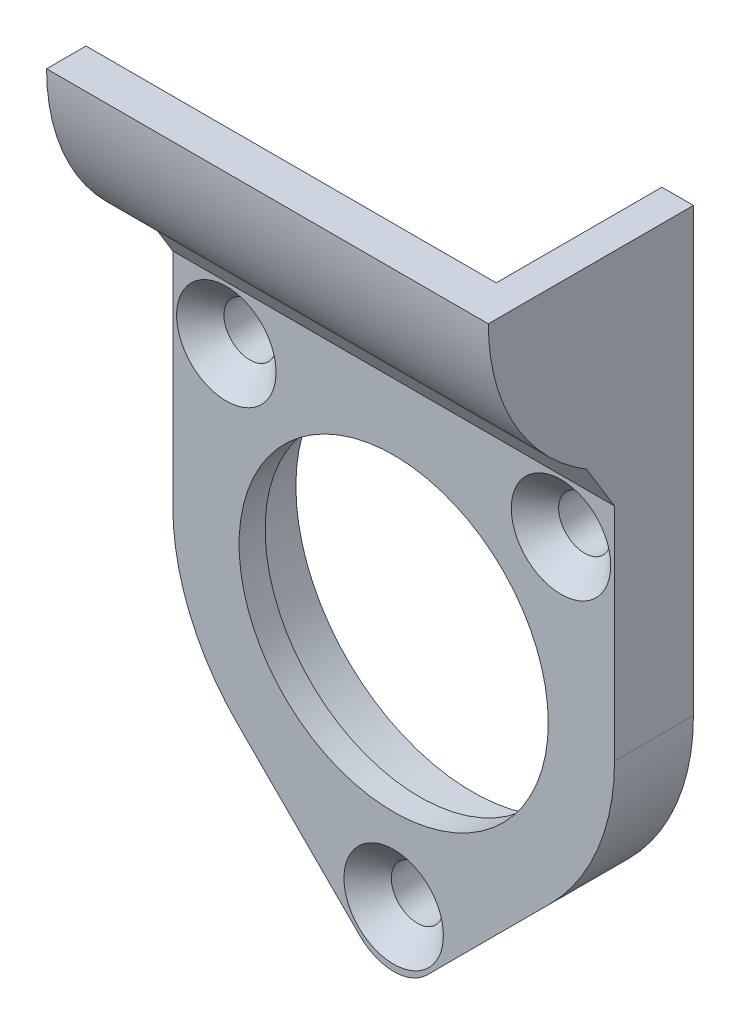
from build123d import *

# Parameters (mm, degrees)
EXTRUDE_3_DEPTH     = 5
SKETCH_1_R          = 9.79888
CUT_EXTRUDE_1_DEPTH = 1.65
SKETCH_1_9_R        = 3.15
SKETCH_3_8_R        = 1.65
SKETCH_3_9_R        = 1.648905
SKETCH_3_9_R_2      = 1.65
CUT_EXTRUDE_2_DEPTH = 5
SKETCH_10_R         = 11.19888
CUT_EXTRUDE_3_DEPTH = 3.35
EXTRUDE_4_DEPTH     = 28
EXTRUDE_5_DEPTH     = 2
EXTRUDE_6_DEPTH     = 28


with BuildPart() as part:
    # 草图7 → 凸台-拉伸3 (new body)
    with BuildSketch(Plane.XY):
        with BuildLine():
            Line((14, 14), (-14, 14))
            Line((-14, 14), (-14, 0))
            ThreePointArc((-14, 0), (-12.934313455, -5.357568053), (-9.899494937, -9.899494937))
            Line((-9.899494937, -9.899494937), (-2.121320344, -17.67766953))
            ThreePointArc((-2.121320344, -17.67766953), (0.000404905, -18.556181469), (2.121892965, -17.677096908))
            Line((2.121892965, -17.677096908), (9.899494937, -9.899494937))
            ThreePointArc((9.899494937, -9.899494937), (12.934313455, -5.357568053), (14, 0))
            Line((14, 0), (14, 14))
        make_face()
    extrude(amount=-EXTRUDE_3_DEPTH)

    # 草图1 → 切除-拉伸1 (cut)
    with BuildSketch(Plane.XY):
        Circle(SKETCH_1_R)
    extrude(amount=-CUT_EXTRUDE_1_DEPTH, mode=Mode.SUBTRACT)

    # 切除-放样1: read off the stored shape, not the designer's step
    # 切除-放样1 outline → 切除-放样1 (revolve, cut)
    with BuildSketch(Plane(origin=(10.6066, 10.606603436, 0), x_dir=(1, 0, 0), z_dir=(0, -1, 0))):
        Polygon((0, 0), (0, -1.5), (1.648905, -1.5), (3.15, 0), align=None)
    revolve(axis=Axis((10.6066, 10.606603436, 0), (0, 0, 1)), mode=Mode.SUBTRACT)

    # 切除-放样2: read off the stored shape, not the designer's step
    # 切除-放样2: loft between two sections, ruled curve by curve
    loft_2_from = [
        Edge.make_bspline([(-8.058196468, 12.45812698, 0), (-4.355149378, 7.361319916, 0), (-9.451956443, 3.658272826, 0), (-13.155003532, 8.755079891, 0), (-16.858050622, 13.851886955, 0), (-11.761243557, 17.554934045, 0), (-8.058196468, 12.45812698, 0)], [0, 0, 0, 0, 0.5, 0.5, 0.5, 1, 1, 1, 1], 3, [1, 0.333333333, 0.333333333, 1, 0.333333333, 0.333333333, 1]),
    ]
    loft_2_to = [
        Edge.make_bspline([(-9.518492924, 11.845518562, -1.5), (-7.040662671, 9.669304411, -1.5), (-9.216876823, 7.191474158, -1.5), (-11.694707076, 9.367688309, -1.5), (-14.172537329, 11.543902461, -1.5), (-11.996323177, 14.021732714, -1.5), (-9.518492924, 11.845518562, -1.5)], [0, 0, 0, 0, 0.5, 0.5, 0.5, 1, 1, 1, 1], 3, [1, 0.333333333, 0.333333333, 1, 0.333333333, 0.333333333, 1]),
    ]
    loft_2 = Solid(Shell([*[Face.make_surface_from_curves(loft_2_from[k], loft_2_to[k]) for k in range(1)], Face(Wire(loft_2_from)), Face(Wire(loft_2_to))]))
    add(loft_2, mode=Mode.SUBTRACT)

    # 草图1<9> → 切除-放样3 section 0
    with BuildSketch(Plane.XY):
        with Locations((0, -14.999996564)):
            Circle(SKETCH_1_9_R)
    # 草图3<8> → 切除-放样3 section 1
    with BuildSketch(Plane.XY.offset(-1.5)):
        with Locations((0, -14.999996564)):
            Circle(SKETCH_3_8_R)
    loft(mode=Mode.SUBTRACT)

    # 草图3<9> → 切除-拉伸2 (cut)
    with BuildSketch(Plane.XY.offset(-1.5)):
        with Locations(Location((-10.6066, 10.606603436, 0), (0, 0, 48.708))):
            Circle(SKETCH_3_9_R)
        with Locations((10.6066, 10.606603436)):
            Circle(SKETCH_3_9_R)
        with Locations((0, -14.999996564)):
            Circle(SKETCH_3_9_R_2)
    extrude(amount=-CUT_EXTRUDE_2_DEPTH, mode=Mode.SUBTRACT)

    # 草图10 → 切除-拉伸3 (cut)
    with BuildSketch(Plane(origin=(0, 0, -5), x_dir=(-1, 0, 0), z_dir=(0, 0, -1))):
        Circle(SKETCH_10_R)
    extrude(amount=-CUT_EXTRUDE_3_DEPTH, mode=Mode.SUBTRACT)



with BuildPart() as body_2:
    # 草图11 → 凸台-拉伸4 (new body)
    with BuildSketch(Plane(origin=(14, 0, 0), x_dir=(0, 0, -1), z_dir=(1, 0, 0))):
        with BuildLine():
            Line((5, 15), (5, 17.5))
            ThreePointArc((5, 17.5), (-2.424621202, 20.575378798), (-5.5, 28))
            Line((-5.5, 28), (-8, 28))
            ThreePointArc((-8, 28), (-4.192388155, 18.807611845), (5, 15))
        make_face()
    extrude(amount=-EXTRUDE_4_DEPTH)

    # 草图13 → 凸台-拉伸5 (add)
    with BuildSketch(Plane.ZY.offset(-14)):
        with BuildLine():
            Line((-5, 28), (-5, 15))
            ThreePointArc((-5, 15), (4.192388155, 18.807611845), (8, 28))
            Line((8, 28), (-5, 28))
        make_face()
    extrude(amount=EXTRUDE_5_DEPTH)


with BuildPart() as part_1:
    add(part.part)

    add(body_2.part)  # 凸台-拉伸6 merges body 2
    # 草图14 → 凸台-拉伸6 (add)
    with BuildSketch(Plane(origin=(-14, 0, 0), x_dir=(0, 0, -1), z_dir=(1, 0, 0))):
        Polygon((0, 14), (-1.780422928, 16.908297474), (5, 16.908297474), (5, 14), align=None)
    extrude(amount=EXTRUDE_6_DEPTH)


solid = part_1.part
